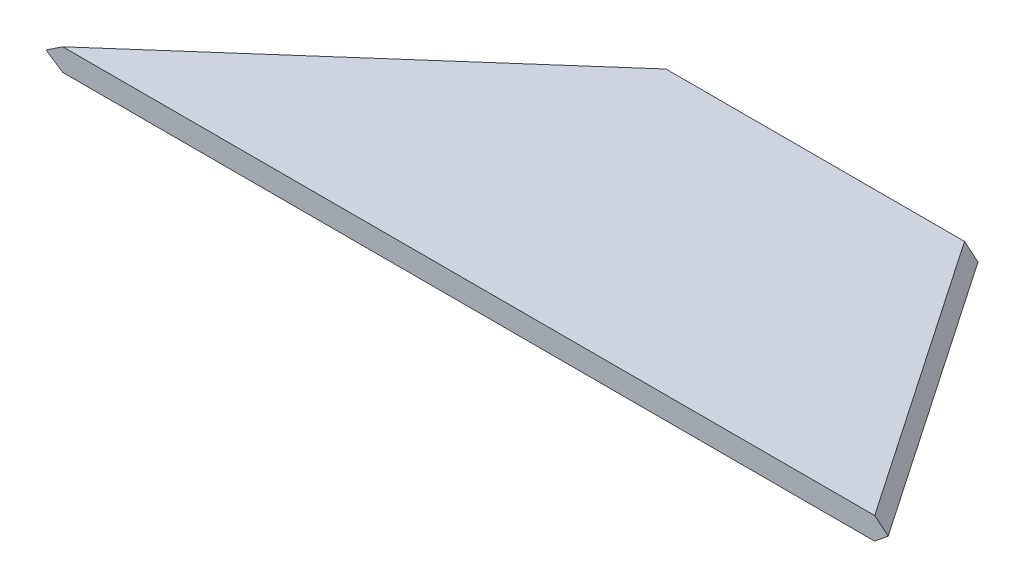
from build123d import *

# Parameters (mm, degrees)
BOSS_EXTRUDE1_DEPTH = 5.2832
CHAMFER1_SIZE       = 3.81
CHAMFER2_SIZE       = 3.81


with BuildPart() as part:
    # Sketch1 → Boss-Extrude1 (new body)
    with BuildSketch(Plane(origin=(0, 0, 0), x_dir=(1, 0, 0), z_dir=(0, 1, 0))):
        Polygon((0, 0), (203.2, 0), (157.48, 67.056), (76.2, 67.056), align=None)
    extrude(amount=BOSS_EXTRUDE1_DEPTH)

    # Chamfer1
    # the kernel refuses this chamfer: 3.81 mm, written as the material it takes off along each edge
    with BuildSketch(Plane(origin=(83.555575257, 5.2832, -73.528906226), x_dir=(-0.018164543083463394, -0.9996219169112968, -0.020641526231208396), z_dir=(-0.7507135169227552, 0, 0.6606278948920248))) as chamfer1_piece_1:
        Polygon((CHAMFER1_SIZE * 0.999621916911, CHAMFER1_SIZE * 0.0274958766106), (-CHAMFER1_SIZE * 0.0274958766106, CHAMFER1_SIZE * 0.999621916911), (0, 0), align=None)
    extrude(amount=121.099658478, mode=Mode.SUBTRACT)
    with BuildSketch(Plane(origin=(83.555575257, 0, -73.528906226), x_dir=(-0.018164543083463394, 0.9996219169112968, -0.020641526231208396), z_dir=(-0.7507135169227552, 0, 0.6606278948920248))) as chamfer1_piece_2:
        Polygon((CHAMFER1_SIZE * 0.999621916911, -CHAMFER1_SIZE * 0.0274958766106), (-CHAMFER1_SIZE * 0.0274958766106, -CHAMFER1_SIZE * 0.999621916911), (0, 0), align=None)
    extrude(amount=121.099658478, mode=Mode.SUBTRACT)

    # Chamfer2
    # the kernel refuses this chamfer: 3.81 mm, written as the material it takes off along each edge
    with BuildSketch(Plane(origin=(208.719637405, 0, 8.095468194), x_dir=(-0.8259149602218081, -0.027495876610586452, 0.5631238365148687), z_dir=(-0.5633368246415095, 0, -0.8262273428075478)), Plane(origin=(208.719637405, 5.2832, 8.095468194), x_dir=(0.022717845070130322, -0.9996219169112966, -0.015489439820543389), z_dir=(-0.5633368246415095, 0, -0.8262273428075478))) as chamfer2_piece_1:
        Polygon((CHAMFER2_SIZE * 0.999621916911, CHAMFER2_SIZE * 0.0274958766106), (-CHAMFER2_SIZE * 0.0274958766106, CHAMFER2_SIZE * 0.999621916911), (0, 0), align=None)
    extrude(amount=100.75548469, mode=Mode.SUBTRACT)


solid = part.part
